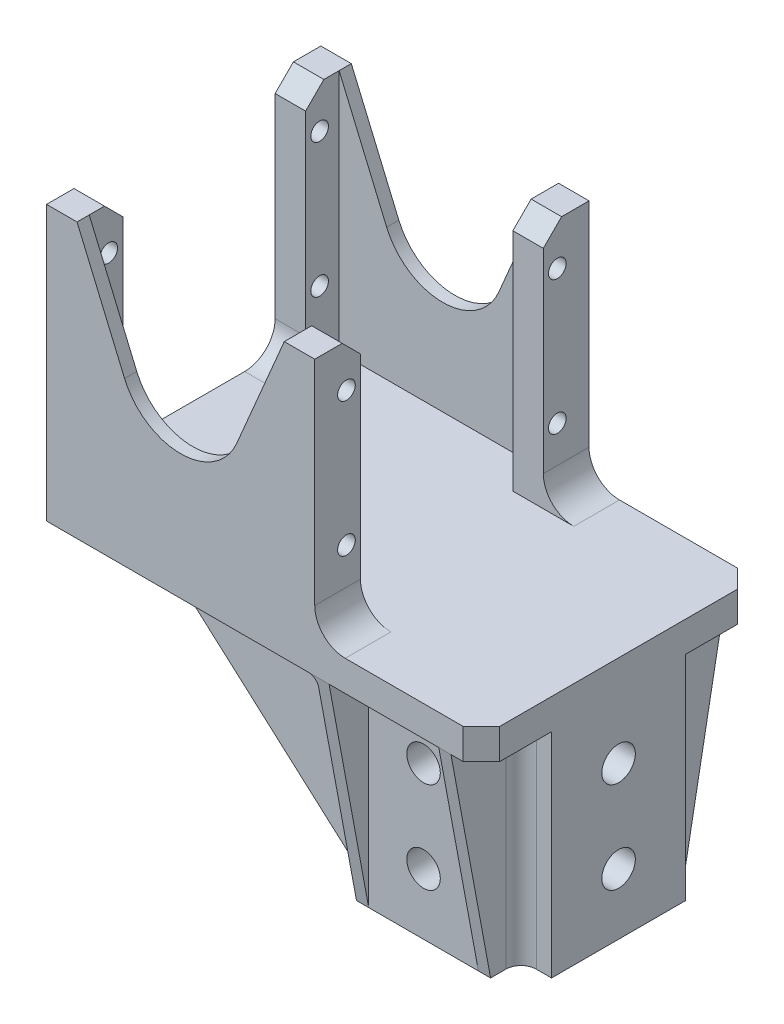
from build123d import *

# Parameters (mm, degrees)
BOSS_EXTRUDE1_DEPTH           = 45
SKETCH3_W                     = 30
SKETCH3_H                     = 40
CUT_EXTRUDE1_DEPTH            = 88.304481557
SKETCH4_W                     = 32
SKETCH4_H                     = 32
SKETCH4_W_2                   = 20.5
SKETCH4_H_2                   = 20.5
BOSS_EXTRUDE2_DEPTH           = 35
SKETCH6_W                     = 5
SKETCH6_H                     = 5
CUT_EXTRUDE4_DEPTH            = 35
RIB1_REACH                    = 87.394
SKETCH9_WALL_W                = 225.450736488
SKETCH9_WALL_H                = 2
LPATTERN1_COUNT               = 2
LPATTERN1_PITCH               = 20
RIB6_REACH                    = 100.659
SKETCH14_WALL_W               = 234.916193708
SKETCH14_WALL_H               = 2
RIB7_START                    = -2
RIB7_DEPTH                    = 2
FILLET2_R                     = 5
FILLET3_R                     = 5
RIB10_REACH                   = 92.525
SKETCH17_WALL_W               = 226.513312862
SKETCH17_WALL_H               = 2
RIB11_REACH                   = 92.525
SKETCH18_WALL_W               = 226.513312862
SKETCH18_WALL_H               = 2
FILLET4_R                     = 10
LPATTERN2_COUNT               = 2
LPATTERN2_PITCH               = 43
FILLET4_OF_LPATTERN2_R        = 10
M5_CLEARANCE_HOLE2_AT_2_COUNT = 2
M5_CLEARANCE_HOLE2_AT_2_PITCH = 15
M2_5_CLEARANCE_HOLE1_D        = 2.9
FILLET5_R                     = 2.5
SKETCH4_4_R                   = 2.5
BOSS_EXTRUDE4_DEPTH           = 8
CIRPATTERN1_COUNT             = 4
CHAMFER1_SIZE                 = 3
FILLET6_R                     = 5
FILLET7_R                     = 1.5


# Read off the part's stored shape, not the designer's step: Rib7
with BuildPart() as part:
    # Sketch2 → Boss-Extrude1 (new body)
    with BuildSketch(Plane.XY):
        Polygon((-53.5125, -22.5), (17.8375, -22.5), (17.8375, -17.5), (-9.5125, -17.5), (-9.5125, 22.5), (-14.5125, 22.5), (-14.5125, -17.5), (-48.5125, -17.5), (-48.5125, 22.5), (-53.5125, 22.5), align=None)
    extrude(amount=BOSS_EXTRUDE1_DEPTH)

    # Sketch3 → Cut-Extrude1 (cut, through all)
    with BuildSketch(Plane(origin=(-53.5125, 0, 0), x_dir=(0, 0, -1), z_dir=(1, 0, 0))):
        with Locations((-22.5, 2.5)):
            Rectangle(SKETCH3_W, SKETCH3_H)
    extrude(amount=CUT_EXTRUDE1_DEPTH, mode=Mode.SUBTRACT)

    # Sketch4 → Boss-Extrude2 (add)
    with BuildSketch(Plane.XZ.offset(22.5)):
        with Locations((1.8375, 22.5)):
            Rectangle(SKETCH4_W, SKETCH4_H)
        with Locations((1.8375, 22.5)):
            Rectangle(SKETCH4_W_2, SKETCH4_H_2, mode=Mode.SUBTRACT)
    extrude(amount=BOSS_EXTRUDE2_DEPTH)

    # Sketch6 → Cut-Extrude4 (cut)
    with BuildSketch(Plane(origin=(0, -57.5, 0), x_dir=(-1, 0, 0), z_dir=(0, -1, 0))):
        with Locations((11.6625, -36)):
            Rectangle(SKETCH6_W, SKETCH6_H)
        with Locations((-15.3375, -36)):
            Rectangle(SKETCH6_W, SKETCH6_H)
        with Locations((-15.3375, -9)):
            Rectangle(SKETCH6_W, SKETCH6_H)
        with Locations((11.6625, -9)):
            Rectangle(SKETCH6_W, SKETCH6_H)
    extrude(amount=-CUT_EXTRUDE4_DEPTH, mode=Mode.SUBTRACT)

    # Sketch9 wall → Rib1 (add, up to next)
    with BuildSketch(Plane(origin=(-33.8375, -40, 33.5), x_dir=(-0.747199752598, 0.664599525818, 0), z_dir=(-0.664599525818, -0.747199752598, 0)), mode=Mode.PRIVATE) as rib1_sk1:
        with Locations((0, 1)):
            Rectangle(SKETCH9_WALL_W, SKETCH9_WALL_H)
    rib1_tool1 = extrude(rib1_sk1.sketch, amount=-RIB1_REACH, mode=Mode.PRIVATE) - part.part
    rib1 = rib1_tool1.solids().sort_by_distance((-33.8375, -40, 33.5))[0]
    add(rib1)

    # LPattern1: Rib1 ×2
    with Locations(*[(0, 0, -i * LPATTERN1_PITCH) for i in range(1, LPATTERN1_COUNT)]):
        add(rib1)

    # Sketch14 wall → Rib6 (add, up to next)
    with BuildSketch(Plane(origin=(12.8375, -40, 3.25), x_dir=(0, 0.983188736076, -0.182592193843), z_dir=(0, 0.182592193843, 0.983188736076)), mode=Mode.PRIVATE) as rib6_sk1:
        with Locations((0, 1)):
            Rectangle(SKETCH14_WALL_W, SKETCH14_WALL_H)
    rib6_tool1 = extrude(rib6_sk1.sketch, amount=RIB6_REACH, mode=Mode.PRIVATE) - part.part
    rib6 = rib6_tool1.solids().sort_by_distance((12.8375, -40, 3.25))[0]
    add(rib6)

    # Rib7 outline → Rib7 (add)
    with BuildSketch(Plane.ZY.offset(9.1625).offset(RIB7_START)):
        Polygon((0, -22.5), (6.5, -57.5), (6.5, -22.5), align=None)
    rib7 = extrude(amount=RIB7_DEPTH)

    # Fillet2
    fillet2_edges = [part.edges().sort_by_distance(p)[0] for p in [
        (1.8375, -22.5, 38.5),
        (-14.1625, -22.5, 22.5),
        (1.8375, -22.5, 6.5),
    ]]
    fillet(fillet2_edges, radius=FILLET2_R)

    # Fillet3
    fillet3_edges = [part.edges().sort_by_distance(p)[0] for p in [
        (-9.5125, -17.5, 41.25),
        (-9.5125, -17.5, 3.75),
    ]]
    fillet(fillet3_edges, radius=FILLET3_R)

    # Sketch17 wall → Rib10 (add, up to next)
    with BuildSketch(Plane(origin=(-40.0125, 2.5, 45), x_dir=(0.391140640345, -0.920330918458, 0), z_dir=(0.920330918458, 0.391140640345, 0)), mode=Mode.PRIVATE) as rib10_sk1:
        with Locations((0, 1)):
            Rectangle(SKETCH17_WALL_W, SKETCH17_WALL_H)
    rib10_tool1 = extrude(rib10_sk1.sketch, amount=-RIB10_REACH, mode=Mode.PRIVATE) - part.part
    rib10 = rib10_tool1.solids().sort_by_distance((-40.0125, 2.5, 45))[0]
    add(rib10)

    # Sketch18 wall → Rib11 (add, up to next)
    with BuildSketch(Plane(origin=(-23.0125, 2.5, 45), x_dir=(0.391140640345, 0.920330918458, 0), z_dir=(-0.920330918458, 0.391140640345, 0)), mode=Mode.PRIVATE) as rib11_sk1:
        with Locations((0, 1)):
            Rectangle(SKETCH18_WALL_W, SKETCH18_WALL_H)
    rib11_tool1 = extrude(rib11_sk1.sketch, amount=-RIB11_REACH, mode=Mode.PRIVATE) - part.part
    rib11 = rib11_tool1.solids().sort_by_distance((-23.0125, 2.5, 45))[0]
    add(rib11)

    # Fillet4
    # the kernel refuses this fillet: 10 mm, written as the material it adds along each edge
    with BuildSketch(Plane(origin=(-31.5125, -17.5, 45), x_dir=(-0.391140640345148, 0.9203309184583486, 0), z_dir=(0, 0, -1))) as fillet4_piece_1:
        with BuildLine():
            CenterArc((FILLET4_R * 2.35294117647, FILLET4_R), FILLET4_R, 136.050984017, 133.949015983)
            Line((FILLET4_R * 1.63298352692, FILLET4_R * 1.69401799894), (0, 0))
            Line((0, 0), (FILLET4_R * 2.35294117647, 0))
        make_face()
    extrude(amount=2)

    # LPattern2: Rib10, Rib11 ×2
    with Locations(*[(0, 0, -i * LPATTERN2_PITCH) for i in range(1, LPATTERN2_COUNT)]):
        add(rib10)
        add(rib11)

    # Fillet4 of LPattern2
    # the kernel refuses this fillet: 10 mm, written as the material it adds along each edge
    with BuildSketch(Plane(origin=(-31.5125, -17.5, 60.823529412), x_dir=(-0.39114064034514817, 0.9203309184583486, 0), z_dir=(0, 0, -1))) as fillet4_of_lpattern2_piece_1_section:
        with BuildLine():
            CenterArc((FILLET4_OF_LPATTERN2_R * 2.35294117647, FILLET4_OF_LPATTERN2_R), FILLET4_OF_LPATTERN2_R, 136.050984017, 133.949015983)
            Line((FILLET4_OF_LPATTERN2_R * 1.63298352692, FILLET4_OF_LPATTERN2_R * 1.69401799894), (0, 0))
            Line((0, 0), (FILLET4_OF_LPATTERN2_R * 2.35294117647, 0))
        make_face()
    fillet4_of_lpattern2_piece_1 = extrude(amount=60.823529412, mode=Mode.PRIVATE)
    fillet4_of_lpattern2_piece_1 = split(fillet4_of_lpattern2_piece_1, bisect_by=Plane(origin=(-31.5125, -6.311496297, 43), z_dir=(0, 0, 1)), keep=Keep.TOP, mode=Mode.PRIVATE)
    fillet4_of_lpattern2_piece_1 = split(fillet4_of_lpattern2_piece_1, bisect_by=Plane(origin=(-31.5125, -6.311496297, 45), z_dir=(0, 0, -1)), keep=Keep.TOP, mode=Mode.PRIVATE)
    add(fillet4_of_lpattern2_piece_1)
    with BuildSketch(Plane(origin=(-31.5125, -17.5, 2), x_dir=(-0.391140640345148, 0.9203309184583486, 0), z_dir=(0, 0, -1))) as fillet4_of_lpattern2_piece_2:
        with BuildLine():
            CenterArc((FILLET4_OF_LPATTERN2_R * 2.35294117647, FILLET4_OF_LPATTERN2_R), FILLET4_OF_LPATTERN2_R, 136.050984017, 133.949015983)
            Line((FILLET4_OF_LPATTERN2_R * 1.63298352692, FILLET4_OF_LPATTERN2_R * 1.69401799894), (0, 0))
            Line((0, 0), (FILLET4_OF_LPATTERN2_R * 2.35294117647, 0))
        make_face()
    extrude(amount=2)

    # Sketch22 → M5 Clearance Hole2 (revolve, cut)
    with BuildSketch(Plane(origin=(1.8375, -32.5, 38.5), x_dir=(0, -1, 0), z_dir=(1, 0, 0))):
        Polygon((0, 0), (0, 7.652366702), (2.75, 6), (2.75, 0), align=None)
    m5_clearance_hole2 = revolve(axis=Axis((1.8375, -32.5, 44.85), (0, 0, -1)), mode=Mode.SUBTRACT)

    # M5 Clearance Hole2 at 2: M5 Clearance Hole2 ×2
    with Locations(*[(0, -i * M5_CLEARANCE_HOLE2_AT_2_PITCH, 0) for i in range(1, M5_CLEARANCE_HOLE2_AT_2_COUNT)]):
        add(m5_clearance_hole2, mode=Mode.SUBTRACT)

    # M2.5 Clearance Hole1 (through all)
    with Locations(Plane.ZY.offset(53.5125)):
        with Locations((5.2, 15.5), (39.8, 15.5), (39.8, -6.5), (5.2, -6.5)):
            Hole(M2_5_CLEARANCE_HOLE1_D / 2)

    # Fillet5
    fillet5_edges = [part.edges().sort_by_distance(p)[0] for p in [
        (-9.1625, -40, 11.5),
        (12.8375, -40, 11.5),
        (12.8375, -40, 33.5),
        (-9.1625, -40, 33.5),
    ]]
    fillet(fillet5_edges, radius=FILLET5_R)

    # Sketch4<4> → Boss-Extrude4 (add)
    with BuildSketch(Plane.XZ.offset(22.5)):
        with Locations(Location((1.8375, 22.5, 0), (0, 0, 180))):
            Circle(SKETCH4_4_R)
    extrude(amount=BOSS_EXTRUDE4_DEPTH)

    # CirPattern1: M5 Clearance Hole2 ×4 about axis
    cirpattern1_axis = Axis((1.8375, -30.5, 22.5), (0, -1, 0))
    for i in range(1, CIRPATTERN1_COUNT):
        add(m5_clearance_hole2.rotate(cirpattern1_axis, i * 360 / CIRPATTERN1_COUNT), mode=Mode.SUBTRACT)

    # CirPattern1 copy 1 sketch → CirPattern1 copy 1 (revolve, cut)
    with BuildSketch(Plane(origin=(-14.1625, -47.5, 22.5), x_dir=(0, -1, 0), z_dir=(0, 0, 1))):
        Polygon((0, 0), (0, 7.652366702), (2.75, 6), (2.75, 0), align=None)
    revolve(axis=Axis((-20.5125, -47.5, 22.5), (1, 0, 0)), mode=Mode.SUBTRACT)

    # CirPattern1 copy 2 sketch → CirPattern1 copy 2 (revolve, cut)
    with BuildSketch(Plane(origin=(1.8375, -47.5, 6.5), x_dir=(0, -1, 0), z_dir=(-1, 0, 0))):
        Polygon((0, 0), (0, 7.652366702), (2.75, 6), (2.75, 0), align=None)
    revolve(axis=Axis((1.8375, -47.5, 0.15), (0, 0, 1)), mode=Mode.SUBTRACT)

    # CirPattern1 copy 3 sketch → CirPattern1 copy 3 (revolve, cut)
    with BuildSketch(Plane(origin=(17.8375, -47.5, 22.5), x_dir=(0, -1, 0), z_dir=(0, 0, -1))):
        Polygon((0, 0), (0, 7.652366702), (2.75, 6), (2.75, 0), align=None)
    revolve(axis=Axis((24.1875, -47.5, 22.5), (-1, 0, 0)), mode=Mode.SUBTRACT)

    # Mirror1: Rib6, Rib7 across plane
    add(rib6.mirror(Plane.XY.offset(22.5)))
    add(rib7.mirror(Plane.XY.offset(22.5)))

    # Chamfer1
    chamfer1_edges = [part.edges().sort_by_distance(p)[0] for p in [
        (17.8375, -20, 0),
        (-12.0125, 22.5, 37.5),
        (-51.0125, 22.5, 37.5),
        (-12.0125, 22.5, 7.5),
        (-51.0125, 22.5, 7.5),
        (17.8375, -20, 45),
    ]]
    chamfer(chamfer1_edges, length=CHAMFER1_SIZE)

    # Fillet6
    fillet6_edges = [part.edges().sort_by_distance(p)[0] for p in [
        (-51.0125, -17.5, 37.5),
        (-51.0125, -17.5, 7.5),
    ]]
    fillet(fillet6_edges, radius=FILLET6_R)

    # Fillet7
    fillet7_edges = [part.edges().sort_by_distance(p)[0] for p in [
        (-9.1625, -22.5, 4.5),
        (-32.5875, -22.5, 33.5),
        (-36.3375, -22.5, 31.5),
        (-36.3375, -22.5, 13.5),
        (-14.1625, -42.5, 13.5),
        (-14.1625, -42.5, 31.5),
        (-15.626966094, -23.964466094, 13.5),
        (-15.626966094, -23.964466094, 31.5),
        (-32.5875, -22.5, 11.5),
        (-9.894733047, -22.5, 10.767766953),
        (-9.1625, -22.5, 40.5),
        (-9.894733047, -22.5, 34.232233047),
    ]]
    fillet(fillet7_edges, radius=FILLET7_R)


solid = part.part
